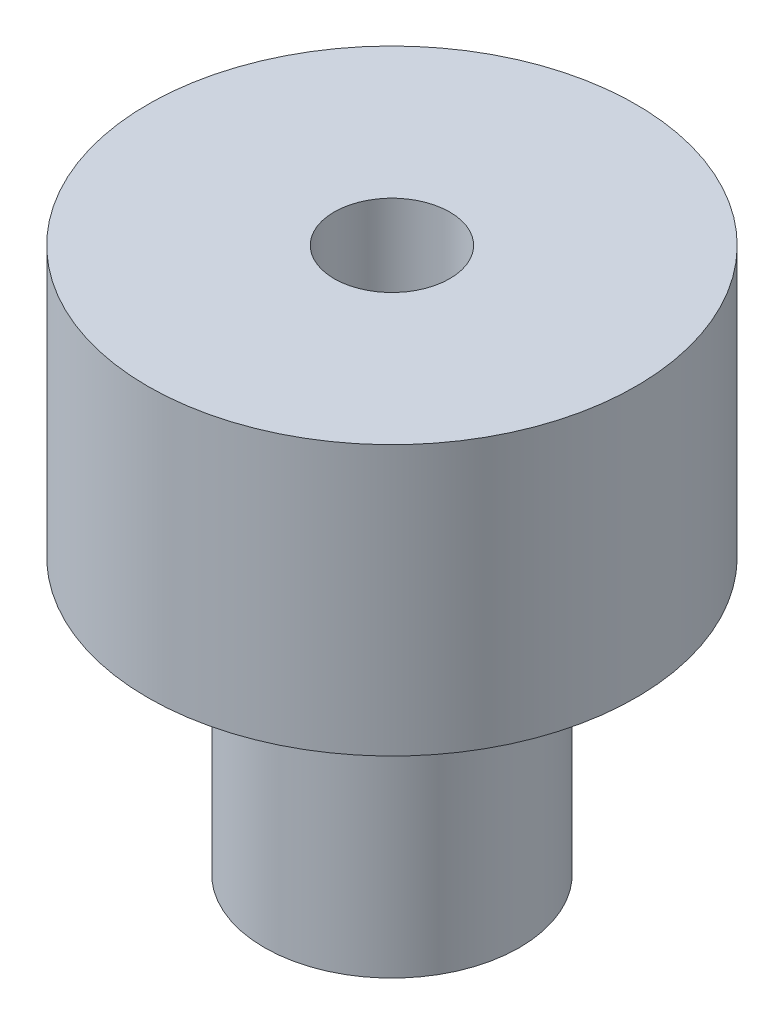
from build123d import *

# Parameters (mm, degrees)
SKETCH1_R           = 6.7
SKETCH1_R_2         = 1.586
BOSS_EXTRUDE1_DEPTH = 7.4
BOSS_EXTRUDE2_START = 7.54
SKETCH2_R           = 3.5
SKETCH2_R_2         = 1.586
BOSS_EXTRUDE2_DEPTH = 7.54
SKETCH3_R           = 1.25
CUT_EXTRUDE1_DEPTH  = 10


with BuildPart() as part:
    # Sketch1 → Boss-Extrude1 (new body)
    with BuildSketch(Plane(origin=(0, 0, 0), x_dir=(1, 0, 0), z_dir=(0, 1, 0))):
        Circle(SKETCH1_R)
        Circle(SKETCH1_R_2, mode=Mode.SUBTRACT)
    extrude(amount=BOSS_EXTRUDE1_DEPTH)

    # Sketch2 → Boss-Extrude2 (add)
    with BuildSketch(Plane.XZ.offset(BOSS_EXTRUDE2_START)):
        Circle(SKETCH2_R)
        Circle(SKETCH2_R_2, mode=Mode.SUBTRACT)
    extrude(amount=-BOSS_EXTRUDE2_DEPTH)

    # Sketch3 → Cut-Extrude1 (cut)
    with BuildSketch(Plane(origin=(0, 0, 0), x_dir=(0, 0, -1), z_dir=(1, 0, 0))):
        with Locations((0, -3.77)):
            Circle(SKETCH3_R)
    extrude(amount=-CUT_EXTRUDE1_DEPTH, mode=Mode.SUBTRACT)


solid = part.part
